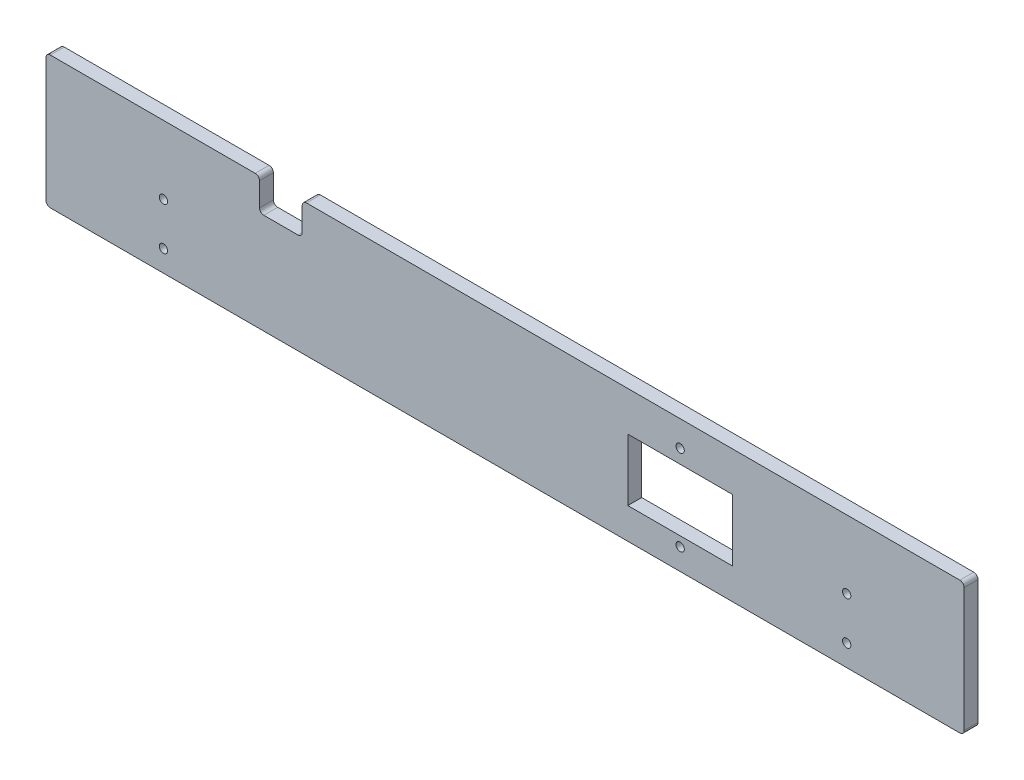
from build123d import *

# Parameters (mm, degrees)
BOSS_EXTRUDE1_DEPTH      = 1.5
BOSS_EXTRUDE1_DEPTH_BACK = 5
SKETCH1_R                = 1.95
SKETCH1_W                = 49
SKETCH1_H                = 29
FILLET1_R                = 2
SKETCH3_R                = 1.95
CUT_EXTRUDE1_DEPTH       = 10


with BuildPart() as part:
    # Sketch1 → Boss-Extrude1 (new, two sides: drawn at the far end of the back side and taken through both)
    with BuildSketch(Plane.XY.offset(-BOSS_EXTRUDE1_DEPTH_BACK)):
        Polygon((-231.924811832, 29.703517588), (78.075188168, 29.703517588), (78.075188168, -32.296482412), (-351.924811832, -32.296482412), (-351.924811832, 29.703517588), (-251.924811832, 29.703517588), (-251.924811832, 14.703517588), (-231.924811832, 14.703517588), align=None)
        with Locations((-54.924811832, 17.703517588)):
            Circle(SKETCH1_R, mode=Mode.SUBTRACT)
        with Locations((-54.924811832, -22.296482412)):
            Circle(SKETCH1_R, mode=Mode.SUBTRACT)
        with Locations((-54.924811832, -3.296482412)):
            Rectangle(SKETCH1_W, SKETCH1_H, mode=Mode.SUBTRACT)
    extrude(amount=BOSS_EXTRUDE1_DEPTH + BOSS_EXTRUDE1_DEPTH_BACK)

    # Fillet1
    fillet1_edges = [part.edges().sort_by_distance(p)[0] for p in [
        (78.075188168, -32.296482412, -1.75),
        (-351.924811832, -32.296482412, -1.75),
        (-351.924811832, 29.703517588, -1.75),
        (-231.924811832, 14.703517588, -1.75),
        (-251.924811832, 14.703517588, -1.75),
        (-251.924811832, 29.703517588, -1.75),
        (-231.924811832, 29.703517588, -1.75),
        (78.075188168, 29.703517588, -1.75),
    ]]
    fillet(fillet1_edges, radius=FILLET1_R)

    # Sketch3 → Cut-Extrude1 (cut)
    with BuildSketch(Plane(origin=(0, 0, -5), x_dir=(-1, 0, 0), z_dir=(0, 0, -1))):
        with Locations((-23.075188168, -22.296482412)):
            Circle(SKETCH3_R)
        with Locations((-23.075188168, -2.296482412)):
            Circle(SKETCH3_R)
        with Locations((296.924811832, -22.296482412)):
            Circle(SKETCH3_R)
        with Locations((296.924811832, -2.296482412)):
            Circle(SKETCH3_R)
    extrude(amount=-CUT_EXTRUDE1_DEPTH, mode=Mode.SUBTRACT)


solid = part.part
